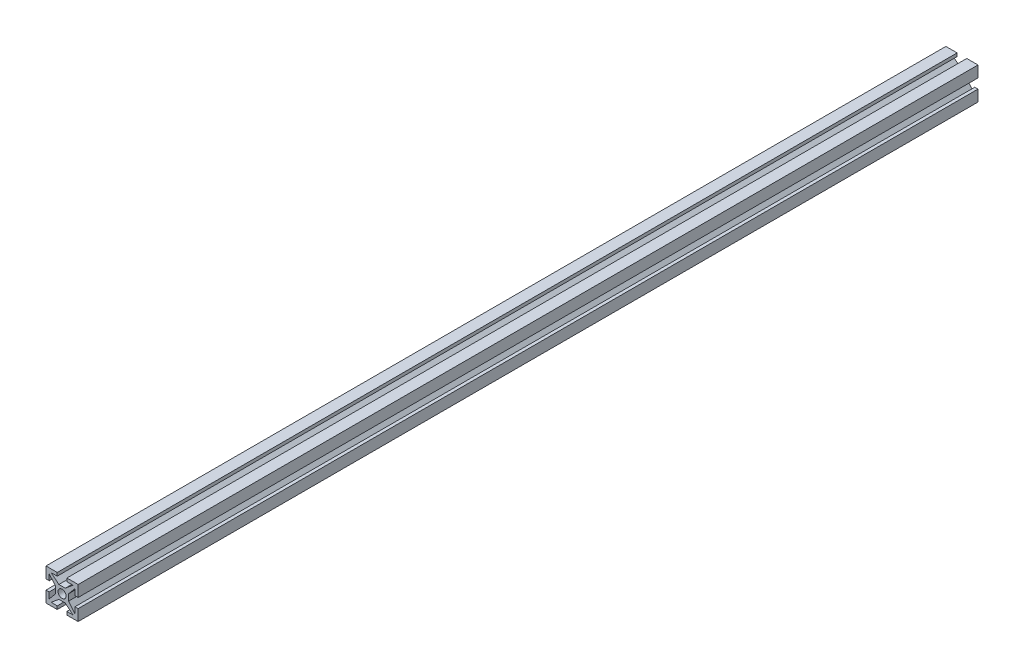
from build123d import *

# Parameters (mm, degrees)
ESQUISSE2_R          = 1.25
MAIN_EXTRUSION_DEPTH = 280


with BuildPart() as part:
    # Esquisse2 → Main Extrusion (new body)
    with BuildSketch(Plane.XY):
        Polygon((-1, -2), (1, -2), (3.383507185, -4), (1.5, -4), (1.5, -5), (5, -5), (5, -1.5), (4, -1.5), (4, -3.383507185), (2, -1), (2, 1), (4, 3.383507185), (4, 1.5), (5, 1.5), (5, 5), (1.5, 5), (1.5, 4), (3.383507185, 4), (1, 2), (-1, 2), (-3.383507185, 4), (-1.5, 4), (-1.5, 5), (-5, 5), (-5, 1.5), (-4, 1.5), (-4, 3.383507185), (-2, 1), (-2, -1), (-4, -3.383507185), (-4, -1.5), (-5, -1.5), (-5, -5), (-1.5, -5), (-1.5, -4), (-3.383507185, -4), align=None)
        Circle(ESQUISSE2_R, mode=Mode.SUBTRACT)
    extrude(amount=MAIN_EXTRUSION_DEPTH)


solid = part.part
